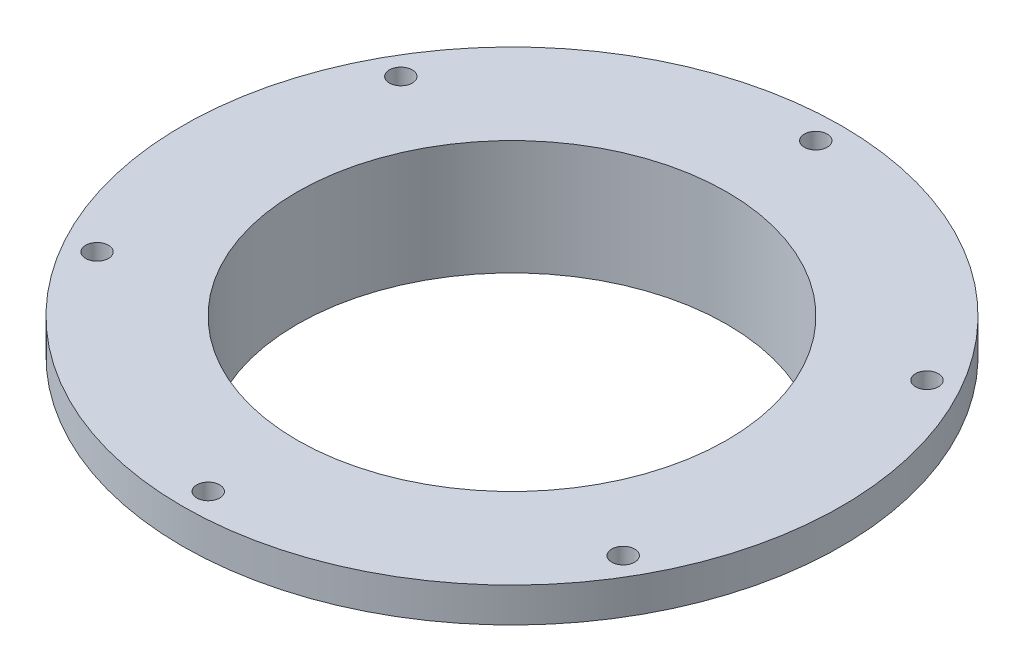
from build123d import *

# Parameters (mm, degrees)
SKETCH2_R          = 2
CUT_EXTRUDE1_DEPTH = 84.740671122


with BuildPart() as part:
    # Sketch1 → Revolve1 (revolve)
    with BuildSketch(Plane(origin=(0, 0, 0), x_dir=(0, 0, -1), z_dir=(1, 0, 0))):
        Polygon((37.5, 66.401492208), (57.5, 80.368434357), (57.5, 86.401492208), (37.5, 86.401492208), align=None)
    revolve(axis=Axis((0, 0, 0), (0, 1, 0)))

    # Sketch2 → Cut-Extrude1 (cut, through all)
    with BuildSketch(Plane(origin=(0, 86.401492208, 0), x_dir=(1, 0, 0), z_dir=(0, 1, 0))):
        with Locations((0, -53)):
            Circle(SKETCH2_R)
        with Locations((-45.899346401, -26.5)):
            Circle(SKETCH2_R)
        with Locations((-45.899346401, 26.5)):
            Circle(SKETCH2_R)
        with Locations((0, 53)):
            Circle(SKETCH2_R)
        with Locations((45.899346401, 26.5)):
            Circle(SKETCH2_R)
        with Locations((45.899346401, -26.5)):
            Circle(SKETCH2_R)
    extrude(amount=-CUT_EXTRUDE1_DEPTH, mode=Mode.SUBTRACT)


solid = part.part
